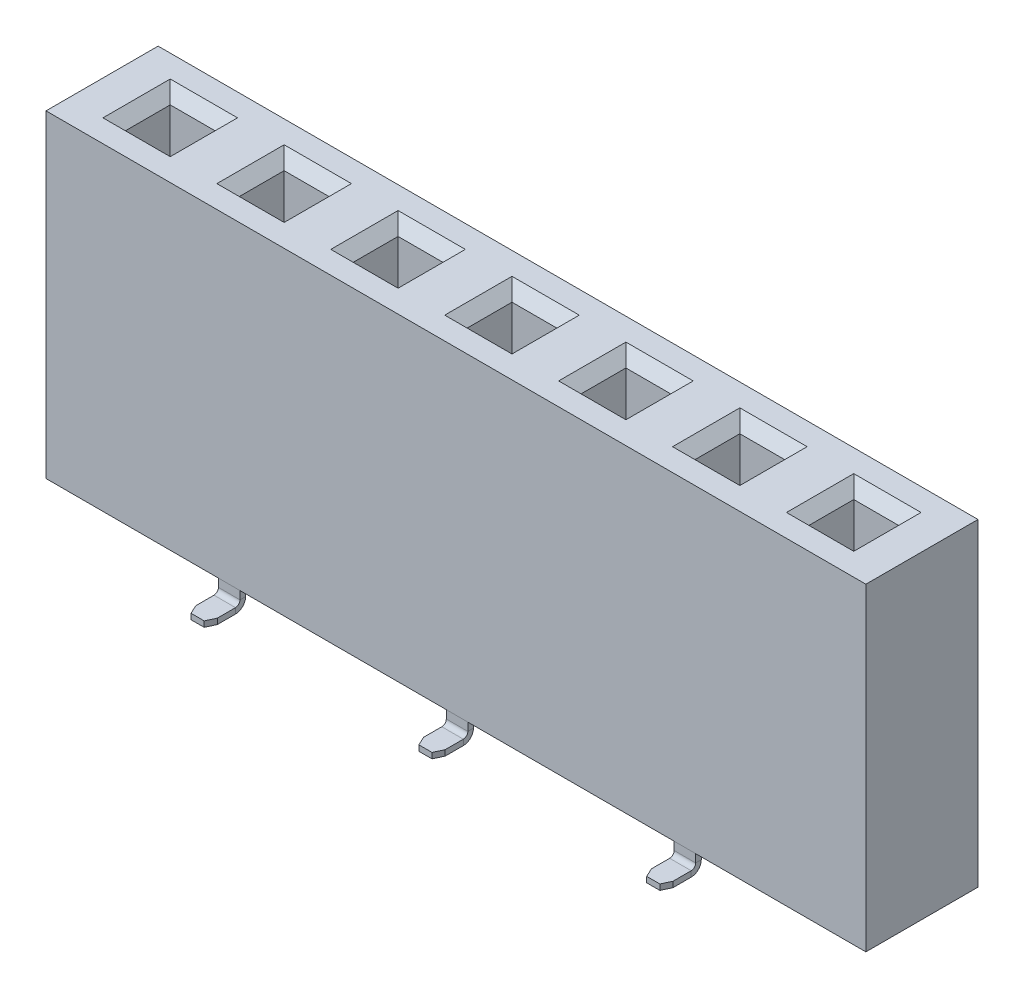
from build123d import *
from OCP.BRepFilletAPI import BRepFilletAPI_MakeChamfer

# Parameters (mm, degrees)
SKETCH1_W                  = 18.28
SKETCH1_H                  = 7.1
BOSS_EXTRUDE1_DEPTH        = 2.5
SKETCH2_W                  = 1
SKETCH2_H                  = 1
CUT_EXTRUDE1_DEPTH         = 2.5
CHAMFER1_SIZE              = 0.25
LPATTERN6_COUNT            = 7
LPATTERN6_PITCH            = 2.54
CHAMFER1_OF_LPATTERN6_SIZE = 0.25
BASE_FLANGE2_DEPTH         = 0.24
BASE_FLANGE2_DEPTH_BACK    = 0.24
BASE_FLANGE3_DEPTH         = 0.24
BASE_FLANGE3_DEPTH_BACK    = 0.24
CHAMFER3_SIZE              = 0.2
CHAMFER3_SIZE2             = 0.093261532
CHAMFER4_SIZE              = 0.2
CHAMFER4_SIZE2             = 0.093261532
LPATTERN4_COUNT            = 4
LPATTERN4_PITCH            = 5.08
LPATTERN3_COUNT            = 3
LPATTERN3_PITCH            = 5.08


# Sheet-metal steps are written as plain solids
with BuildPart() as part:
    # Sketch1 → Boss-Extrude1 (new body)
    with BuildSketch(Plane.XY):
        Rectangle(SKETCH1_W, SKETCH1_H)
    extrude(amount=BOSS_EXTRUDE1_DEPTH)

    # Sketch2 → Cut-Extrude1 (cut)
    with BuildSketch(Plane(origin=(0, 3.55, 0), x_dir=(1, 0, 0), z_dir=(0, 1, 0))):
        with Locations((-7.62, -1.25)):
            Rectangle(SKETCH2_W, SKETCH2_H)
    cut_extrude1 = extrude(amount=-CUT_EXTRUDE1_DEPTH, mode=Mode.SUBTRACT)

    # Chamfer1
    chamfer1_edges = [part.edges().sort_by_distance(p)[0] for p in [
        (-7.12, 3.55, 1.25),
        (-7.62, 3.55, 0.75),
        (-8.12, 3.55, 1.25),
        (-7.62, 3.55, 1.75),
    ]]
    chamfer(chamfer1_edges, length=CHAMFER1_SIZE)

    # LPattern6: Cut-Extrude1 ×7
    with Locations(*[(i * LPATTERN6_PITCH, 0, 0) for i in range(1, LPATTERN6_COUNT)]):
        add(cut_extrude1, mode=Mode.SUBTRACT)

    # Chamfer1 of LPattern6
    chamfer1_of_lpattern6_edges = [part.edges().sort_by_distance(p)[0] for p in [
        (-4.58, 3.55, 1.25),
        (-5.08, 3.55, 0.75),
        (-5.58, 3.55, 1.25),
        (-5.08, 3.55, 1.75),
        (-2.04, 3.55, 1.25),
        (-2.54, 3.55, 0.75),
        (-3.04, 3.55, 1.25),
        (-2.54, 3.55, 1.75),
        (0.5, 3.55, 1.25),
        (0, 3.55, 0.75),
        (-0.5, 3.55, 1.25),
        (0, 3.55, 1.75),
        (3.04, 3.55, 1.25),
        (2.54, 3.55, 0.75),
        (2.04, 3.55, 1.25),
        (2.54, 3.55, 1.75),
        (5.58, 3.55, 1.25),
        (5.08, 3.55, 0.75),
        (4.58, 3.55, 1.25),
        (5.08, 3.55, 1.75),
        (8.12, 3.55, 1.25),
        (7.62, 3.55, 0.75),
        (7.12, 3.55, 1.25),
        (7.62, 3.55, 1.75),
    ]]
    chamfer(chamfer1_of_lpattern6_edges, length=CHAMFER1_OF_LPATTERN6_SIZE)


with BuildPart() as body_2:
    # Sketch5 → Base-Flange2 (new, two sides: drawn at the far end of the back side and taken through both)
    with BuildSketch(Plane.ZY.offset(7.62).offset(-BASE_FLANGE2_DEPTH_BACK)):
        with BuildLine():
            Line((0.15, -3.55), (0.15, -3.755))
            ThreePointArc((0.15, -3.755), (0.084099026, -3.914099026), (-0.075, -3.98))
            Line((-0.075, -3.98), (-0.68, -3.98))
            Line((-0.68, -3.98), (-0.68, -3.855))
            Line((-0.68, -3.855), (-0.075, -3.855))
            ThreePointArc((-0.075, -3.855), (-0.004289322, -3.825710678), (0.025, -3.755))
            Line((0.025, -3.755), (0.025, -3.55))
            Line((0.025, -3.55), (0.15, -3.55))
        make_face()
    extrude(amount=BASE_FLANGE2_DEPTH + BASE_FLANGE2_DEPTH_BACK)

    # Chamfer4: one chamfer whose edges measure the first distance from different faces: ONE call of the kernel's chamfer builder (chamfer() names one face for all edges)
    chamfer4_edges_1 = [body_2.edges().sort_by_distance(p)[0] for p in [
        (-7.38, -3.9175, -0.68),
    ]]
    chamfer4_side_1 = [body_2.faces().sort_by_distance(p)[0] for p in [
        (-7.38, -3.6525, 0.034347727),
    ]]
    chamfer4_edges_2 = [body_2.edges().sort_by_distance(p)[0] for p in [
        (-7.86, -3.9175, -0.68),
    ]]
    chamfer4_side_2 = [body_2.faces().sort_by_distance(p)[0] for p in [
        (-7.86, -3.6525, 0.034347727),
    ]]
    chamfer4 = BRepFilletAPI_MakeChamfer(body_2.part.solid().wrapped)
    for e in chamfer4_edges_1:
        chamfer4.Add(CHAMFER4_SIZE, CHAMFER4_SIZE2, e.wrapped, chamfer4_side_1[0].wrapped)  # the first distance lies on this face
    for e in chamfer4_edges_2:
        chamfer4.Add(CHAMFER4_SIZE, CHAMFER4_SIZE2, e.wrapped, chamfer4_side_2[0].wrapped)  # the first distance lies on this face
    add(Compound.cast(chamfer4.Shape()), mode=Mode.REPLACE)


with BuildPart() as body_3:
    # Sketch22 → Base-Flange3 (new, two sides: drawn at the far end of the back side and taken through both)
    with BuildSketch(Plane.ZY.offset(5.08).offset(-BASE_FLANGE3_DEPTH_BACK)):
        with BuildLine():
            Line((2.35, -3.55), (2.35, -3.755))
            ThreePointArc((2.35, -3.755), (2.415900974, -3.914099026), (2.575, -3.98))
            Line((2.575, -3.98), (3.18, -3.98))
            Line((3.18, -3.98), (3.18, -3.855))
            Line((3.18, -3.855), (2.575, -3.855))
            ThreePointArc((2.575, -3.855), (2.504289322, -3.825710678), (2.475, -3.755))
            Line((2.475, -3.755), (2.475, -3.55))
            Line((2.475, -3.55), (2.35, -3.55))
        make_face()
    extrude(amount=BASE_FLANGE3_DEPTH + BASE_FLANGE3_DEPTH_BACK)

    # Chamfer3: one chamfer whose edges measure the first distance from different faces: ONE call of the kernel's chamfer builder (chamfer() names one face for all edges)
    chamfer3_edges_1 = [body_3.edges().sort_by_distance(p)[0] for p in [
        (-4.84, -3.9175, 3.18),
    ]]
    chamfer3_side_1 = [body_3.faces().sort_by_distance(p)[0] for p in [
        (-4.84, -3.6525, 2.465652273),
    ]]
    chamfer3_edges_2 = [body_3.edges().sort_by_distance(p)[0] for p in [
        (-5.32, -3.9175, 3.18),
    ]]
    chamfer3_side_2 = [body_3.faces().sort_by_distance(p)[0] for p in [
        (-5.32, -3.6525, 2.465652273),
    ]]
    chamfer3 = BRepFilletAPI_MakeChamfer(body_3.part.solid().wrapped)
    for e in chamfer3_edges_1:
        chamfer3.Add(CHAMFER3_SIZE, CHAMFER3_SIZE2, e.wrapped, chamfer3_side_1[0].wrapped)  # the first distance lies on this face
    for e in chamfer3_edges_2:
        chamfer3.Add(CHAMFER3_SIZE, CHAMFER3_SIZE2, e.wrapped, chamfer3_side_2[0].wrapped)  # the first distance lies on this face
    add(Compound.cast(chamfer3.Shape()), mode=Mode.REPLACE)


with BuildPart() as lpattern4_1:
    # LPattern4: pattern copy
    add(body_2.part.moved(Location(Vector(1, 0, 0) * (1 * LPATTERN4_PITCH))))


with BuildPart() as lpattern4_2:
    # LPattern4: pattern copy
    add(body_2.part.moved(Location(Vector(1, 0, 0) * (2 * LPATTERN4_PITCH))))


with BuildPart() as lpattern4_3:
    # LPattern4: pattern copy
    add(body_2.part.moved(Location(Vector(1, 0, 0) * (3 * LPATTERN4_PITCH))))


with BuildPart() as lpattern3_1:
    # LPattern3: pattern copy
    add(body_3.part.moved(Location(Vector(1, 0, 0) * (1 * LPATTERN3_PITCH))))


with BuildPart() as lpattern3_2:
    # LPattern3: pattern copy
    add(body_3.part.moved(Location(Vector(1, 0, 0) * (2 * LPATTERN3_PITCH))))


solid = Compound([part.part, body_2.part, body_3.part, lpattern4_1.part, lpattern4_2.part, lpattern4_3.part, lpattern3_1.part, lpattern3_2.part])
